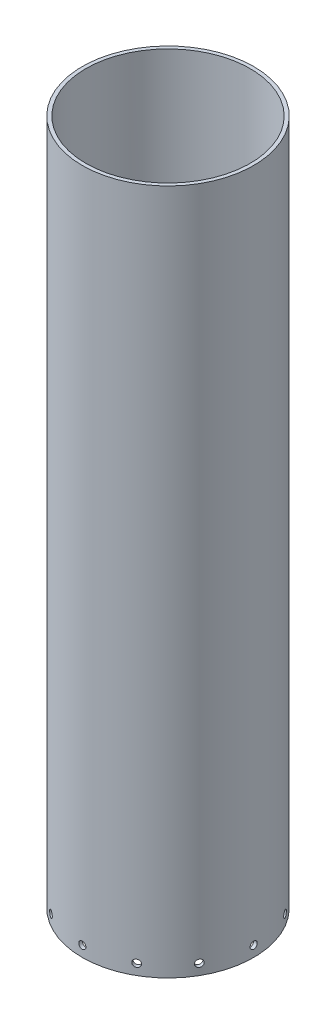
from build123d import *

# Parameters (mm, degrees)
SKETCH2_R           = 76.2
SKETCH2_R_2         = 73.025
BOSS_EXTRUDE1_DEPTH = 609.6
SKETCH3_R           = 3.175
CUT_EXTRUDE1_DEPTH  = 620.051726433
CIRPATTERN1_COUNT   = 12


with BuildPart() as part:
    # Sketch2 → Boss-Extrude1 (new body)
    with BuildSketch(Plane(origin=(0, 0, 0), x_dir=(1, 0, 0), z_dir=(0, 1, 0))):
        Circle(SKETCH2_R)
        Circle(SKETCH2_R_2, mode=Mode.SUBTRACT)
    extrude(amount=BOSS_EXTRUDE1_DEPTH)

    # Sketch3 → Cut-Extrude1 (cut, through all)
    with BuildSketch(Plane.XY):
        with Locations((0, 9.525)):
            Circle(SKETCH3_R)
    cut_extrude1 = extrude(amount=-CUT_EXTRUDE1_DEPTH, mode=Mode.SUBTRACT)

    # CirPattern1: Cut-Extrude1 ×12 about axis
    cirpattern1_axis = Axis((0, 0, 0), (0, 1, 0))
    for i in range(1, CIRPATTERN1_COUNT):
        add(cut_extrude1.rotate(cirpattern1_axis, i * 360 / CIRPATTERN1_COUNT), mode=Mode.SUBTRACT)


solid = part.part
